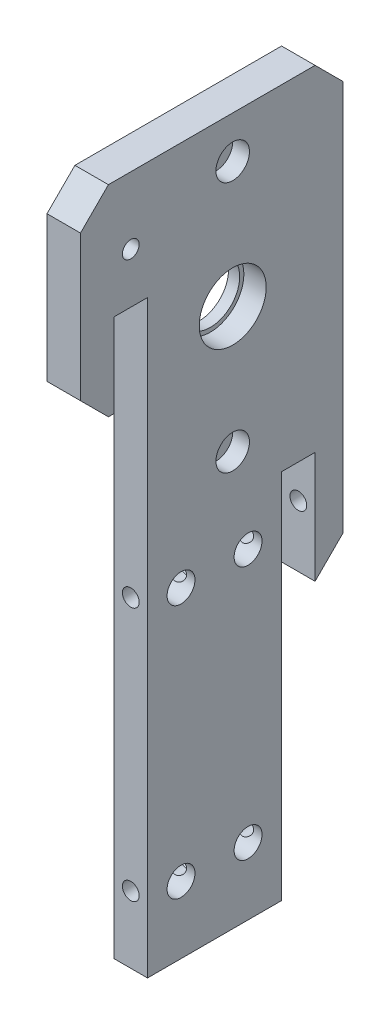
from build123d import *

# Parameters (mm, degrees)
SKETCH1_W                         = 59
SKETCH1_H                         = 120
SKETCH1_R                         = 10.5
BOSS_EXTRUDE1_DEPTH               = 12
BOSS_EXTRUDE2_DEPTH               = 12
SKETCH9_W                         = 48
SKETCH9_H                         = 133
BOSS_EXTRUDE3_DEPTH               = 12
SKETCH11_W                        = 10
SKETCH11_H                        = 160
BOSS_EXTRUDE4_DEPTH               = 12
CHAMFER1_SIZE                     = 10
CHAMFER2_SIZE                     = 10
F_10_0_10_DIAMETER_HOLE1_D        = 10
F_6_0_6_DIAMETER_HOLE1_AT_2_COUNT = 2
F_6_0_6_DIAMETER_HOLE1_AT_2_PITCH = 91
F_6_0_6_DIAMETER_HOLE3_D          = 6
F_6_0_6_DIAMETER_HOLE3_DEPTH      = 20
F_6_0_6_DIAMETER_HOLE3_TIP        = 1.802581857
F_6_0_6_DIAMETER_HOLE4_D          = 6
F_6_0_6_DIAMETER_HOLE5_D          = 6
F_6_0_6_DIAMETER_HOLE5_DEPTH      = 20
F_6_0_6_DIAMETER_HOLE5_TIP        = 1.802581857
HOLE2_D                           = 12
HOLE2_DEPTH                       = 6
SKETCH27_R                        = 12
CUT_EXTRUDE1_DEPTH                = 8


with BuildPart() as part:
    # Sketch1 → Boss-Extrude1 (new body)
    with BuildSketch(Plane(origin=(0, 0, 0), x_dir=(0, 0, -1), z_dir=(1, 0, 0))):
        Rectangle(SKETCH1_W, SKETCH1_H)
        Circle(SKETCH1_R, mode=Mode.SUBTRACT)
    extrude(amount=BOSS_EXTRUDE1_DEPTH)

    # Sketch8 → Boss-Extrude2 (add)
    with BuildSketch(Plane.ZY):
        Polygon((42.5, 18), (42.5, -12), (54.5, -12), (54.5, 60), (29.5, 60), (29.5, -60), (30.5, -60), (30.5, 18), align=None)
    extrude(amount=-BOSS_EXTRUDE2_DEPTH)

    # Sketch9 → Boss-Extrude3 (add)
    with BuildSketch(Plane.ZY):
        with Locations((6.5, -126.5)):
            Rectangle(SKETCH9_W, SKETCH9_H)
    extrude(amount=-BOSS_EXTRUDE3_DEPTH)

    # Sketch11 → Boss-Extrude4 (add)
    with BuildSketch(Plane(origin=(12, 0, 0), x_dir=(0, 0, -1), z_dir=(1, 0, 0))):
        with Locations((34.5, -20)):
            Rectangle(SKETCH11_W, SKETCH11_H)
    extrude(amount=-BOSS_EXTRUDE4_DEPTH)

    # Chamfer1
    chamfer1_edges = [part.edges().sort_by_distance(p)[0] for p in [
        (6, 60, 54.5),
        (6, -12, 54.5),
        (6, 60, -39.5),
    ]]
    chamfer(chamfer1_edges, length=CHAMFER1_SIZE)

    # Chamfer2
    chamfer2_edges = [part.edges().sort_by_distance(p)[0] for p in [
        (6, -100, -39.5),
    ]]
    chamfer(chamfer2_edges, length=CHAMFER2_SIZE - 0.0001)  # a hair under: the kernel refuses the full size

    # Ø10.0 (10) Diameter Hole1 (through all)
    with Locations(Plane(origin=(12, 0, 0), x_dir=(0, 0, -1), z_dir=(1, 0, 0))):
        with Locations((-18.5, -169), (5.5, -169), (-18.5, -78), (5.5, -78)):
            Hole(F_10_0_10_DIAMETER_HOLE1_D / 2)

    # Sketch15 → Ø6.0 (6) Diameter Hole1 (revolve, cut)
    with BuildSketch(Plane(origin=(6, -169, -17.5), x_dir=(0, 1, 0), z_dir=(1, 0, 0))):
        Polygon((0, 0), (0, 21.802581857), (3, 20), (3, 0), align=None)
    f_6_0_6_diameter_hole1 = revolve(axis=Axis((6, -169, -23.85), (0, 0, 1)), mode=Mode.SUBTRACT)

    # Ø6.0 (6) Diameter Hole1 at 2: Ø6.0 (6) Diameter Hole1 ×2
    with Locations(*[(0, i * F_6_0_6_DIAMETER_HOLE1_AT_2_PITCH, 0) for i in range(1, F_6_0_6_DIAMETER_HOLE1_AT_2_COUNT)]):
        add(f_6_0_6_diameter_hole1, mode=Mode.SUBTRACT)

    # Ø6.0 (6) Diameter Hole3
    with Locations(Plane(origin=(0, 0, -39.5), x_dir=(-1, 0, 0), z_dir=(0, 0, -1))):
        with Locations((-6, -78)):
            Hole(F_6_0_6_DIAMETER_HOLE3_D / 2, depth=F_6_0_6_DIAMETER_HOLE3_DEPTH)
            with Locations((0, 0, -(F_6_0_6_DIAMETER_HOLE3_DEPTH + F_6_0_6_DIAMETER_HOLE3_TIP / 2))):  # 118° drill point
                Cone(0, F_6_0_6_DIAMETER_HOLE3_D / 2, F_6_0_6_DIAMETER_HOLE3_TIP, mode=Mode.SUBTRACT)

    # Ø6.0 (6) Diameter Hole4 (through all)
    with Locations(Plane(origin=(12, 0, 0), x_dir=(0, 0, -1), z_dir=(1, 0, 0))):
        with Locations((-36.5, 36)):
            Hole(F_6_0_6_DIAMETER_HOLE4_D / 2)

    # Ø6.0 (6) Diameter Hole5
    with Locations(Plane.XY.offset(30.5)):
        with Locations((6, -78), (6, -169)):
            Hole(F_6_0_6_DIAMETER_HOLE5_D / 2, depth=F_6_0_6_DIAMETER_HOLE5_DEPTH)
            with Locations((0, 0, -(F_6_0_6_DIAMETER_HOLE5_DEPTH + F_6_0_6_DIAMETER_HOLE5_TIP / 2))):  # 118° drill point
                Cone(0, F_6_0_6_DIAMETER_HOLE5_D / 2, F_6_0_6_DIAMETER_HOLE5_TIP, mode=Mode.SUBTRACT)

    # Hole2
    with Locations(Plane(origin=(12, 0, 0), x_dir=(0, 0, -1), z_dir=(1, 0, 0))):
        with Locations((0, -45), (0, 45)):
            Hole(HOLE2_D / 2, depth=HOLE2_DEPTH)

    # Sketch27 → Cut-Extrude1 (cut)
    with BuildSketch(Plane(origin=(12, 0, 0), x_dir=(0, 0, -1), z_dir=(1, 0, 0))):
        Circle(SKETCH27_R)
    extrude(amount=-CUT_EXTRUDE1_DEPTH, mode=Mode.SUBTRACT)


solid = part.part
